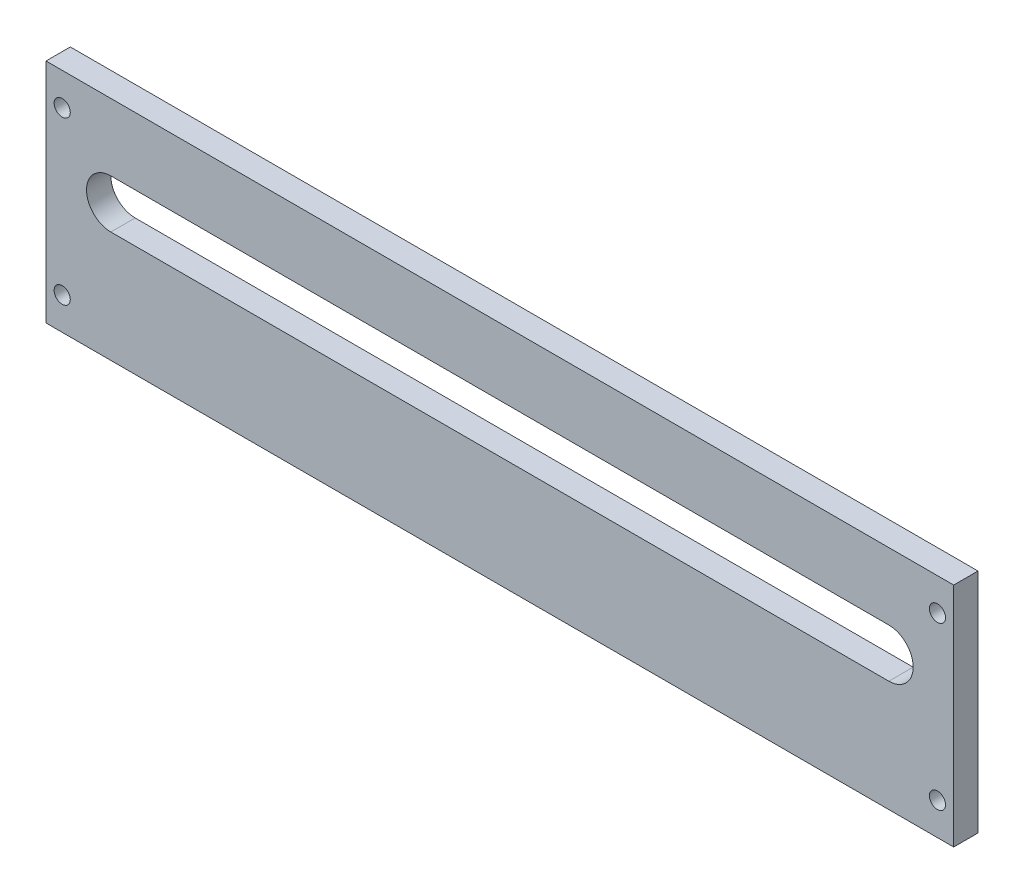
from build123d import *

# Parameters (mm, degrees)
SKETCH1_W           = 355.6
SKETCH1_H           = 88.9
BOSS_EXTRUDE1_DEPTH = 9.525
SKETCH2_R           = 3.1623
CUT_EXTRUDE1_DEPTH  = 367.667827366
CUT_EXTRUDE2_DEPTH  = 367.667827366


with BuildPart() as part:
    # Sketch1 → Boss-Extrude1 (new body)
    with BuildSketch(Plane.XY):
        with Locations((177.8, 44.45)):
            Rectangle(SKETCH1_W, SKETCH1_H)
    extrude(amount=BOSS_EXTRUDE1_DEPTH)

    # Sketch2 → Cut-Extrude1 (cut, through all)
    with BuildSketch(Plane.XY.offset(9.525)):
        with Locations((6.35, 76.2)):
            Circle(SKETCH2_R)
        with Locations((6.35, 12.7)):
            Circle(SKETCH2_R)
        with Locations((349.25, 76.2)):
            Circle(SKETCH2_R)
        with Locations((349.25, 12.7)):
            Circle(SKETCH2_R)
    extrude(amount=-CUT_EXTRUDE1_DEPTH, mode=Mode.SUBTRACT)

    # Sketch3 → Cut-Extrude2 (cut, through all)
    with BuildSketch(Plane.XY.offset(9.525)):
        with BuildLine():
            Line((25.4, 62.62497), (330.2, 62.62497))
            ThreePointArc((330.2, 62.62497), (339.725, 53.09997), (330.2, 43.57497))
            Line((330.2, 43.57497), (25.4, 43.57497))
            ThreePointArc((25.4, 43.57497), (15.875, 53.09997), (25.4, 62.62497))
        make_face()
    extrude(amount=-CUT_EXTRUDE2_DEPTH, mode=Mode.SUBTRACT)


solid = part.part
